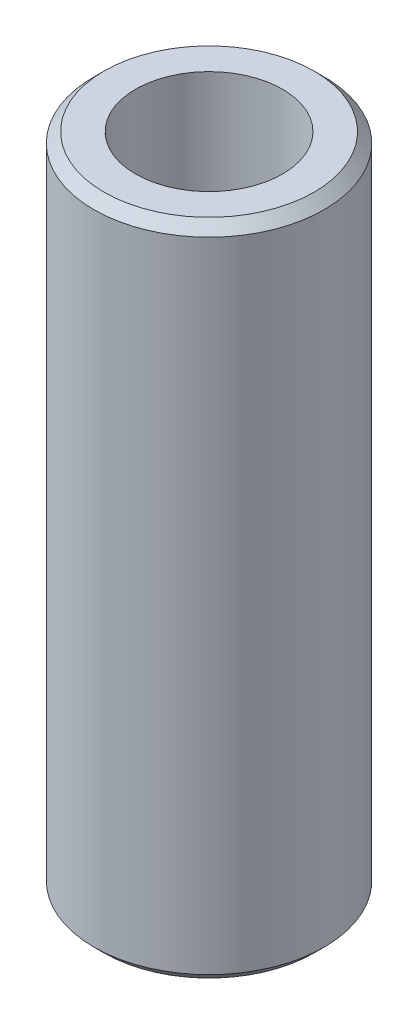
from build123d import *

# Parameters (mm, degrees)
SKETCH1_R           = 50
BOSS_EXTRUDE1_DEPTH = 286.217433179
SKETCH2_R           = 31.932214297
CUT_EXTRUDE1_DEPTH  = 295.822690877
CHAMFER1_SIZE       = 4.38864159


with BuildPart() as part:
    # Sketch1 → Boss-Extrude1 (new body)
    with BuildSketch(Plane(origin=(0, 0, 0), x_dir=(1, 0, 0), z_dir=(0, 1, 0))):
        Circle(SKETCH1_R)
    extrude(amount=BOSS_EXTRUDE1_DEPTH)

    # Sketch2 → Cut-Extrude1 (cut, through all)
    with BuildSketch(Plane(origin=(0, 0, 0), x_dir=(1, 0, 0), z_dir=(0, 1, 0))):
        Circle(SKETCH2_R)
    extrude(amount=CUT_EXTRUDE1_DEPTH, mode=Mode.SUBTRACT)

    # Chamfer1
    chamfer1_edges = [part.edges().sort_by_distance(p)[0] for p in [
        (-50, 286.217433179, 0),
        (-50, 0, 0),
    ]]
    chamfer(chamfer1_edges, length=CHAMFER1_SIZE)


solid = part.part
